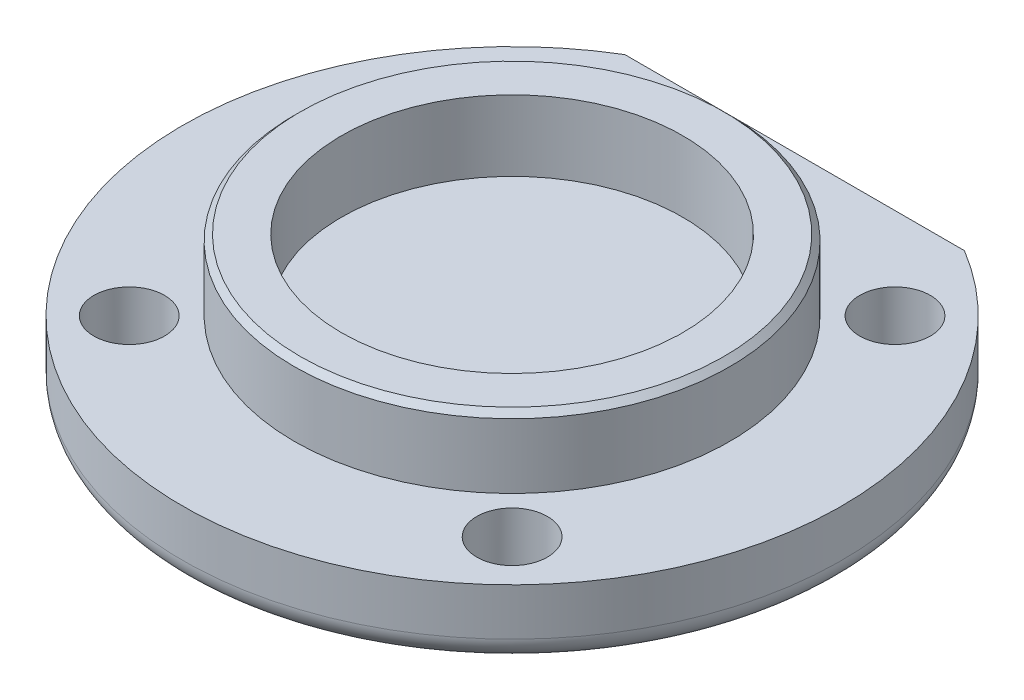
from build123d import *

# Parameters (mm, degrees)
SKETCH_1_R      = 3
EXTRUDE_1_DEPTH = 6
SKETCH_2_R      = 18.5
SKETCH_2_R_2    = 14.5
EXTRUDE_2_DEPTH = 6
FILLET_1_R      = 2
CHAMFER_1_SIZE  = 0.5


with BuildPart() as part:
    # 草图1 → 凸台-拉伸1 (new body)
    with BuildSketch(Plane(origin=(0, 0, 0), x_dir=(1, 0, 0), z_dir=(0, 1, 0))):
        with BuildLine():
            Line((-14.422205102, 24), (14.422205102, 24))
            ThreePointArc((14.422205102, 24), (0, -28), (-14.422205102, 24))
        make_face()
        with Locations(Location((-16.263455967, 16.263455967, 0), (0, 0, 270))):
            Circle(SKETCH_1_R, mode=Mode.SUBTRACT)
        with Locations(Location((16.263455967, 16.263455967, 0), (0, 0, 270))):
            Circle(SKETCH_1_R, mode=Mode.SUBTRACT)
        with Locations(Location((16.263455967, -16.263455967, 0), (0, 0, 270))):
            Circle(SKETCH_1_R, mode=Mode.SUBTRACT)
        with Locations(Location((-16.263455967, -16.263455967, 0), (0, 0, 270))):
            Circle(SKETCH_1_R, mode=Mode.SUBTRACT)
    extrude(amount=EXTRUDE_1_DEPTH)

    # 草图2 → 凸台-拉伸2 (add)
    with BuildSketch(Plane(origin=(0, 6, 0), x_dir=(1, 0, 0), z_dir=(0, 1, 0))):
        with Locations(Location((0, 0, 0), (0, 0, 270))):
            Circle(SKETCH_2_R)
        with Locations(Location((0, 0, 0), (0, 0, 270))):
            Circle(SKETCH_2_R_2, mode=Mode.SUBTRACT)
    extrude(amount=EXTRUDE_2_DEPTH)

    # 圆角1
    fillet_1_edges = [part.edges().sort_by_distance(p)[0] for p in [
        (0, 0, 28),
    ]]
    fillet(fillet_1_edges, radius=FILLET_1_R - 0.0001)  # a hair under: the kernel refuses the full size

    # 倒角1
    chamfer_1_edges = [part.edges().sort_by_distance(p)[0] for p in [
        (0, 12, -18.5),
    ]]
    chamfer(chamfer_1_edges, length=CHAMFER_1_SIZE)


solid = part.part
